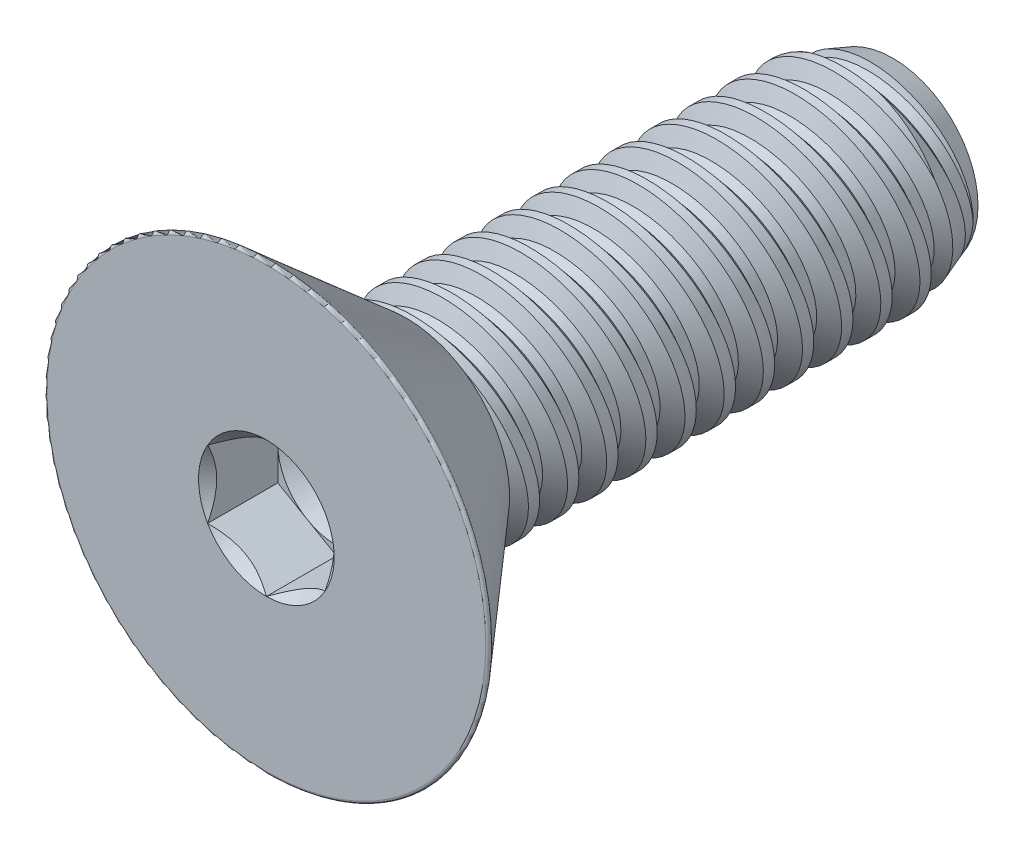
from build123d import *

# Parameters (mm, degrees)
SKETCH1_W          = 9.8552
SKETCH1_H          = 2.0828
LPATTERN1_COUNT    = 12
LPATTERN1_PITCH    = 0.79375
LPATTERN2_COUNT    = 2
LPATTERN2_PITCH    = 0.79375
SKETCH4_R          = 4.5593
EXTRUDE1_DEPTH     = 2.8448
FILLET1_R          = 0.0508
CUT_EXTRUDE1_DEPTH = 1.4224
SKETCH8_R          = 1.190625
CUT_EXTRUDE5_DEPTH = 0.474133333
CUT_EXTRUDE5_DRAFT = -60


with BuildPart() as part:
    # Sketch1 → Revolve1 (revolve)
    with BuildSketch(Plane(origin=(0, 0, 0), x_dir=(0, 0, -1), z_dir=(1, 0, 0)), mode=Mode.PRIVATE) as revolve1_sk:
        with Locations((4.9276, 1.0414)):
            Rectangle(SKETCH1_W, SKETCH1_H)
    revolve(revolve1_sk.sketch.rotate(Axis((0, 0, 0), (0, 0, 1)), 143.466023127), axis=Axis((0, 0, 0), (0, 0, 1)))

    # Sketch2 → Cut-Revolve1 (revolve, cut)
    with BuildSketch(Plane(origin=(0, 0, 0), x_dir=(0, 0, -1), z_dir=(1, 0, 0)), mode=Mode.PRIVATE) as cut_revolve1_sk:
        Polygon((0.097465104, 2.101371857), (0.779720832, 2.231374854), (0.61647657, 1.762908932), (0.421546362, 1.725765218), align=None)
    cut_revolve1 = revolve(cut_revolve1_sk.sketch.rotate(Axis((0, -0.162231854, 0), (0, 0.18718091792156116, -0.9823254572523517)), 180), axis=Axis((0, -0.162231854, 0), (0, 0.18718091792156116, -0.9823254572523517)), mode=Mode.SUBTRACT)

    # Sketch3 → Cut-Revolve2 (revolve, cut)
    with BuildSketch(Plane(origin=(0, 0, 0), x_dir=(0, 0, -1), z_dir=(1, 0, 0)), mode=Mode.PRIVATE) as cut_revolve2_sk:
        Polygon((9.8552, 1.725765218), (8.874255, 2.0828), (9.8552, 2.0828), align=None)
    revolve(cut_revolve2_sk.sketch.rotate(Axis((0, 0, -8.874255), (0, 0, 1)), 143.466023127), axis=Axis((0, 0, -8.874255), (0, 0, 1)), mode=Mode.SUBTRACT)

    # LPattern1: Cut-Revolve1 ×12
    with Locations(*[(0, 0, -i * LPATTERN1_PITCH) for i in range(1, LPATTERN1_COUNT)]):
        add(cut_revolve1, mode=Mode.SUBTRACT)

    # LPattern2: Cut-Revolve1 ×2
    with Locations(*[(0, 0, i * LPATTERN2_PITCH) for i in range(1, LPATTERN2_COUNT)]):
        add(cut_revolve1, mode=Mode.SUBTRACT)

    # Sketch4 → Extrude1 (add)
    with BuildSketch(Plane.XY):
        Circle(SKETCH4_R)
    extrude(amount=EXTRUDE1_DEPTH)

    # Sketch9 → Cut-Revolve3 (revolve, cut)
    with BuildSketch(Plane(origin=(0, 0, 0), x_dir=(0, 0, -1), z_dir=(1, 0, 0)), mode=Mode.PRIVATE) as cut_revolve3_sk:
        Polygon((-2.8448, 4.5593), (0, 2.086353088), (0, 4.5593), align=None)
    revolve(cut_revolve3_sk.sketch.rotate(Axis((0, 0, 0), (0, 0, 1)), 136.412456754), axis=Axis((0, 0, 0), (0, 0, 1)), mode=Mode.SUBTRACT)

    # Fillet1
    fillet1_edges = [part.edges().sort_by_distance(p)[0] for p in [
        (3.143464481, 3.302400271, 2.8448),
    ]]
    fillet(fillet1_edges, radius=FILLET1_R)

    # Sketch6 → Cut-Extrude1 (cut)
    with BuildSketch(Plane.XY.offset(2.8448)):
        Polygon((0, -1.374815329), (1.190625, -0.687407664), (1.190625, 0.687407664), (0, 1.374815329), (-1.190625, 0.687407664), (-1.190625, -0.687407664), align=None)
    extrude(amount=-CUT_EXTRUDE1_DEPTH, mode=Mode.SUBTRACT)

    # Cut-Extrude4 cone 1 section (through the dimple's axis) → Cut-Extrude4 (revolve, cut)
    with BuildSketch(Plane(origin=(0, 0, 2.8448), x_dir=(0, -1, 0), z_dir=(1, 0, 0))):
        Polygon((0, 0), (1.374815329, 0), (0, 1.374815329), align=None)
    revolve(axis=Axis((0, 0, 2.8448), (0, 0, -1)), mode=Mode.SUBTRACT)


with BuildPart() as cut_extrude5_tool:
    # Sketch8 → Cut-Extrude5 (with draft: the straight prism first)
    with BuildSketch(Plane.XY.offset(1.4224)):
        Circle(SKETCH8_R)
    extrude(amount=-CUT_EXTRUDE5_DEPTH)
    # Cut-Extrude5: the draft: its side faces are tilted about the plane it starts from
    cut_extrude5_sides = [cut_extrude5_tool.faces().sort_by_distance(p)[0] for p in [
        (-1.190625, 0, 1.185333333),
    ]]
    draft(cut_extrude5_sides, Plane.XY.offset(1.4224), CUT_EXTRUDE5_DRAFT)


with BuildPart() as part_1:
    add(part.part)

    # Cut-Extrude5: cut by cut_extrude5_tool
    add(cut_extrude5_tool.part, mode=Mode.SUBTRACT)


solid = part_1.part
